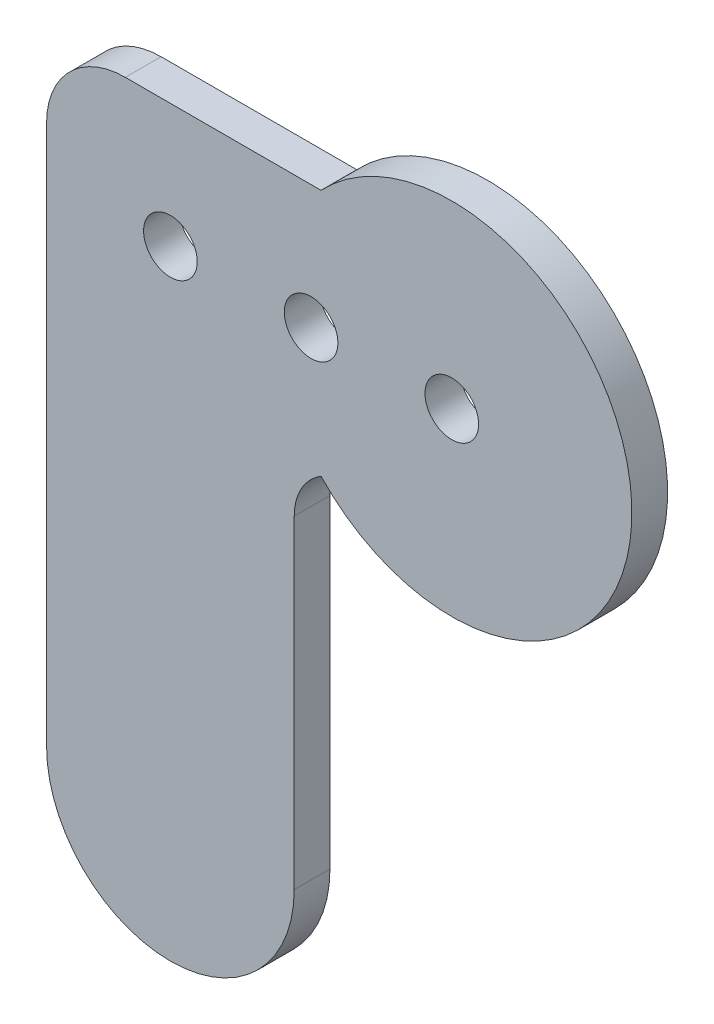
from build123d import *

# Parameters (mm, degrees)
BOSS_EXTRUDE1_DEPTH = 3.175
FILLET1_R           = 7
FILLET2_R           = 5
SKETCH2_R           = 2.38125
CUT_EXTRUDE1_DEPTH  = 66.810946088
LPATTERN1_COUNT     = 3
LPATTERN1_PITCH     = 12.5


with BuildPart() as part:
    # Sketch1 → Boss-Extrude1 (new body)
    with BuildSketch(Plane.XY):
        with BuildLine():
            Line((-11.618950039, 11), (-36, 11))
            Line((-36, 11), (-36, -44))
            ThreePointArc((-36, -44), (-25, -55), (-14, -44))
            Line((-14, -44), (-14, -11))
            Line((-14, -11), (-11.618950039, -11))
            ThreePointArc((-11.618950039, -11), (16, 0), (-11.618950039, 11))
        make_face()
    extrude(amount=BOSS_EXTRUDE1_DEPTH)

    # Fillet1
    fillet1_edges = [part.edges().sort_by_distance(p)[0] for p in [
        (-36, 11, 1.5875),
    ]]
    fillet(fillet1_edges, radius=FILLET1_R)

    # Fillet2
    # the kernel refuses this fillet: 5 mm, written as the material it adds along each edge
    with BuildSketch(Plane(origin=(-14, -11, 0), x_dir=(1, 0, 0), z_dir=(0, 0, 1))) as fillet2_piece_1:
        with BuildLine():
            CenterArc((5, -4.259237102), FILLET2_R, 121.586822832, 58.413177168)
            Line((0, -4.259237102), (-0.1, -4.259237102))
            Line((-0.1, -4.259237102), (-0.1, 0))
            Line((-0.1, 0), (0, 0.1))
            ThreePointArc((0, 0.1), (1.190524981, 0.1), (2.328670961, 0.085184742))
            Line((2.328670961, 0.085184742), (2.381049961, 0))
        make_face()
    extrude(amount=3.175)

    # Sketch2 → Cut-Extrude1 (cut, through all)
    with BuildSketch(Plane.XY.offset(3.175)):
        Circle(SKETCH2_R)
    cut_extrude1 = extrude(amount=-CUT_EXTRUDE1_DEPTH, mode=Mode.SUBTRACT)

    # LPattern1: Cut-Extrude1 ×3
    with Locations(*[(-i * LPATTERN1_PITCH, 0, 0) for i in range(1, LPATTERN1_COUNT)]):
        add(cut_extrude1, mode=Mode.SUBTRACT)


solid = part.part
